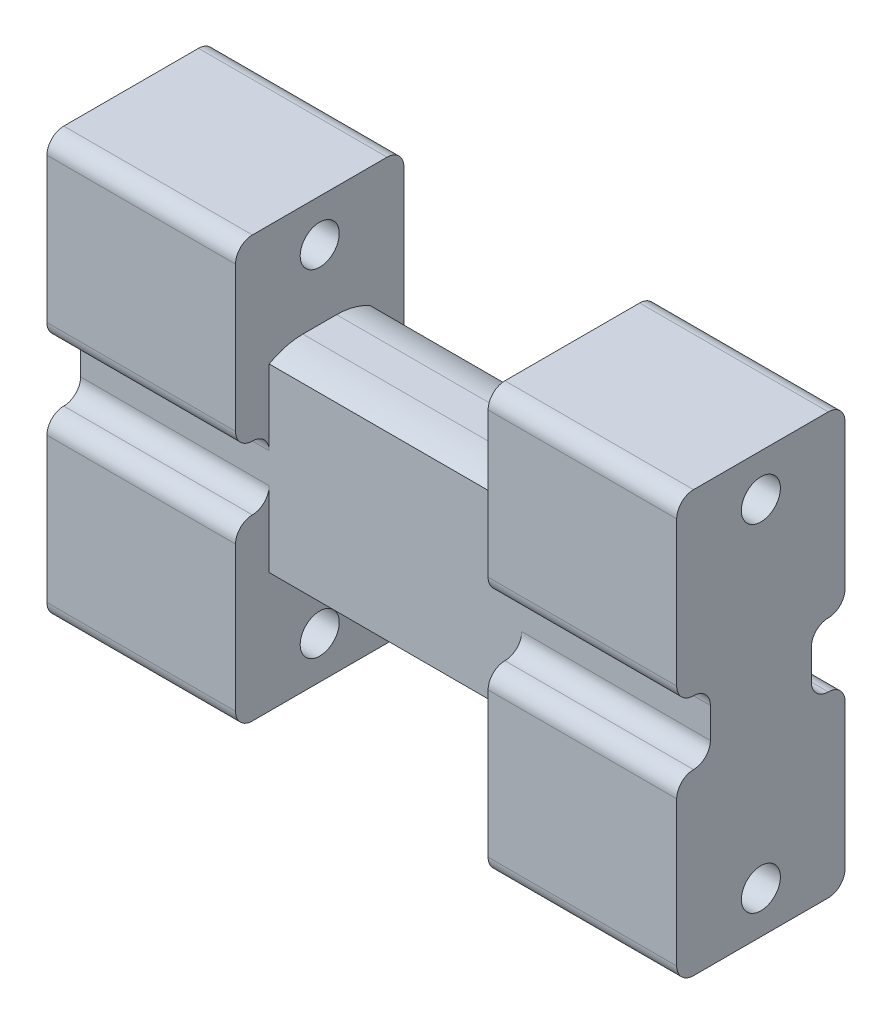
from build123d import *

# Parameters (mm, degrees)
SKETCH1_W           = 47.498
SKETCH1_H           = 12.7
BOSS_EXTRUDE1_DEPTH = 31.75
SKETCH2_R           = 1.4732
CUT_EXTRUDE1_DEPTH  = 47.498
SKETCH3_W           = 19.05
SKETCH3_H           = 8.382
CUT_EXTRUDE2_DEPTH  = 47.498
FILLET1_R           = 5.08
SKETCH4_W           = 47.498
SKETCH4_H           = 4.826
CUT_EXTRUDE3_DEPTH  = 2.54
SKETCH5_W           = 47.498
SKETCH5_H           = 4.826
CUT_EXTRUDE4_DEPTH  = 2.54
SKETCH6_W           = 19.05
SKETCH6_H           = 19.05
CUT_EXTRUDE5_DEPTH  = 2.54
SKETCH7_W           = 19.05
SKETCH7_H           = 17.006147254
CUT_EXTRUDE6_DEPTH  = 2.54
FILLET2_R           = 1.27


with BuildPart() as part:
    # Sketch1 → Boss-Extrude1 (new body)
    with BuildSketch(Plane(origin=(0, 0, 0), x_dir=(1, 0, 0), z_dir=(0, 1, 0))):
        with Locations((23.749, 6.35)):
            Rectangle(SKETCH1_W, SKETCH1_H)
    extrude(amount=BOSS_EXTRUDE1_DEPTH)

    # Sketch2 → Cut-Extrude1 (cut)
    with BuildSketch(Plane.ZY):
        with Locations((-6.35, 3.175)):
            Circle(SKETCH2_R)
        with Locations((-6.35, 28.575)):
            Circle(SKETCH2_R)
    extrude(amount=-CUT_EXTRUDE1_DEPTH, mode=Mode.SUBTRACT)

    # Sketch3 → Cut-Extrude2 (cut)
    with BuildSketch(Plane(origin=(0, 0, -12.7), x_dir=(-1, 0, 0), z_dir=(0, 0, -1))):
        with Locations((-23.749, 4.191)):
            Rectangle(SKETCH3_W, SKETCH3_H)
        with Locations((-23.749, 27.559)):
            Rectangle(SKETCH3_W, SKETCH3_H)
    extrude(amount=-CUT_EXTRUDE2_DEPTH, mode=Mode.SUBTRACT)

    # Fillet1
    fillet1_edges = [part.edges().sort_by_distance(p)[0] for p in [
        (23.749, 8.382, 0),
        (23.749, 8.382, -12.7),
        (23.749, 23.368, 0),
        (23.749, 23.368, -12.7),
    ]]
    fillet(fillet1_edges, radius=FILLET1_R)

    # Sketch4 → Cut-Extrude3 (cut)
    with BuildSketch(Plane.XY):
        with Locations((23.749, 15.875)):
            Rectangle(SKETCH4_W, SKETCH4_H)
    extrude(amount=-CUT_EXTRUDE3_DEPTH, mode=Mode.SUBTRACT)

    # Sketch5 → Cut-Extrude4 (cut)
    with BuildSketch(Plane(origin=(0, 0, -12.7), x_dir=(-1, 0, 0), z_dir=(0, 0, -1))):
        with Locations((-23.749, 15.875)):
            Rectangle(SKETCH5_W, SKETCH5_H)
    extrude(amount=-CUT_EXTRUDE4_DEPTH, mode=Mode.SUBTRACT)

    # Sketch6 → Cut-Extrude5 (cut)
    with BuildSketch(Plane.XY):
        with Locations((23.749, 17.907)):
            Rectangle(SKETCH6_W, SKETCH6_H)
    extrude(amount=-CUT_EXTRUDE5_DEPTH, mode=Mode.SUBTRACT)

    # Sketch7 → Cut-Extrude6 (cut)
    with BuildSketch(Plane(origin=(0, 0, -12.7), x_dir=(-1, 0, 0), z_dir=(0, 0, -1))):
        with Locations((-23.749, 16.885073627)):
            Rectangle(SKETCH7_W, SKETCH7_H)
    extrude(amount=-CUT_EXTRUDE6_DEPTH, mode=Mode.SUBTRACT)

    # Fillet2
    fillet2_edges = [part.edges().sort_by_distance(p)[0] for p in [
        (40.386, 13.462, 0),
        (40.386, 13.462, -2.54),
        (40.386, 18.288, -2.54),
        (40.386, 18.288, 0),
        (7.112, 13.462, 0),
        (7.112, 13.462, -2.54),
        (7.112, 18.288, -2.54),
        (7.112, 18.288, 0),
        (7.112, 31.75, 0),
        (40.386, 31.75, 0),
        (7.112, 0, 0),
        (40.386, 0, 0),
        (40.386, 0, -12.7),
        (40.386, 31.75, -12.7),
        (40.386, 13.462, -12.7),
        (40.386, 13.462, -10.16),
        (40.386, 18.288, -10.16),
        (40.386, 18.288, -12.7),
        (7.112, 31.75, -12.7),
        (7.112, 18.288, -12.7),
        (7.112, 18.288, -10.16),
        (7.112, 0, -12.7),
        (7.112, 13.462, -12.7),
        (7.112, 13.462, -10.16),
    ]]
    fillet(fillet2_edges, radius=FILLET2_R - 0.0001)  # a hair under: the kernel refuses the full size


solid = part.part
